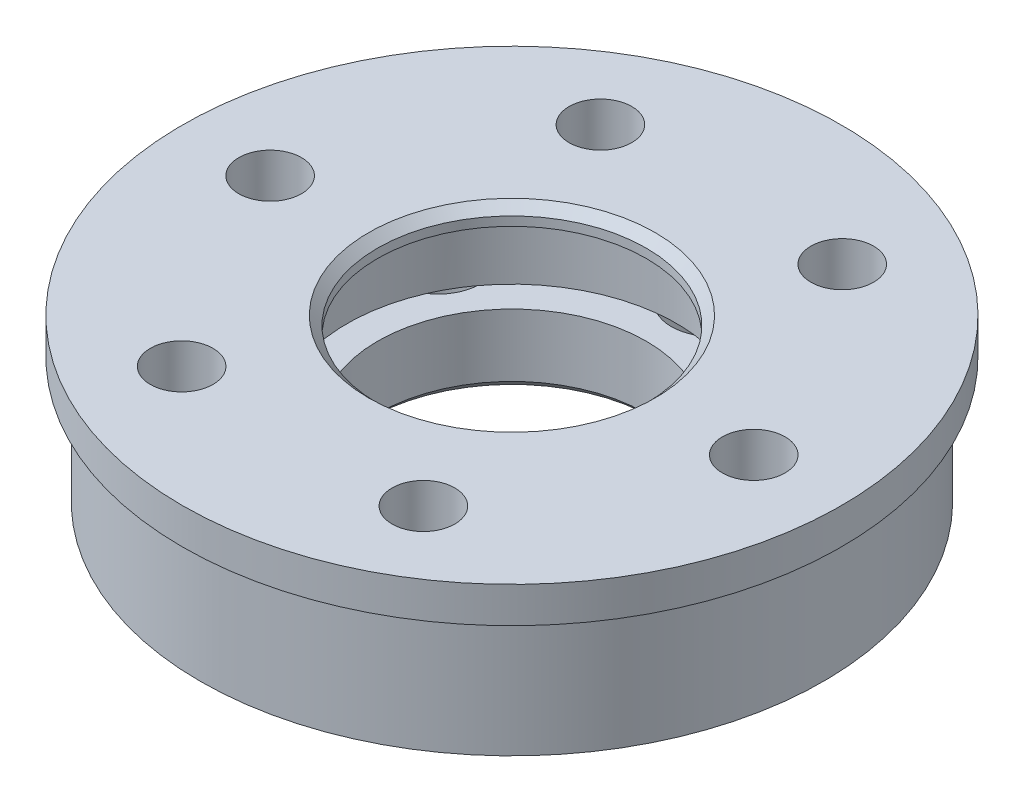
from build123d import *

# Parameters (mm, degrees)
SKETCH1_R           = 17.4
SKETCH1_R_2         = 1.75
SKETCH1_R_3         = 7.5
BOSS_EXTRUDE1_DEPTH = 4.5
CUT_EXTRUDE1_START  = -0.5
SKETCH2_R           = 9.2
CUT_EXTRUDE1_DEPTH  = 4
SKETCH3_R           = 15.25
SKETCH3_R_2         = 11.75
BOSS_EXTRUDE2_DEPTH = 1.5
CHAMFER1_SIZE       = 0.5
SKETCH4_R           = 18.4
SKETCH4_R_2         = 17.4
BOSS_EXTRUDE3_DEPTH = 2
SKETCH5_R           = 2.35
CUT_EXTRUDE2_DEPTH  = 4


with BuildPart() as part:
    # Sketch1 → Boss-Extrude1 (new, symmetric)
    with BuildSketch(Plane(origin=(0, 0, 0), x_dir=(1, 0, 0), z_dir=(0, 1, 0))):
        Circle(SKETCH1_R)
        with Locations((13.5, 0)):
            Circle(SKETCH1_R_2, mode=Mode.SUBTRACT)
        with Locations((6.75, -11.691342951)):
            Circle(SKETCH1_R_2, mode=Mode.SUBTRACT)
        with Locations((-6.75, -11.691342951)):
            Circle(SKETCH1_R_2, mode=Mode.SUBTRACT)
        with Locations((-13.5, 0)):
            Circle(SKETCH1_R_2, mode=Mode.SUBTRACT)
        with Locations((-6.75, 11.691342951)):
            Circle(SKETCH1_R_2, mode=Mode.SUBTRACT)
        with Locations((6.75, 11.691342951)):
            Circle(SKETCH1_R_2, mode=Mode.SUBTRACT)
        Circle(SKETCH1_R_3, mode=Mode.SUBTRACT)
    extrude(amount=BOSS_EXTRUDE1_DEPTH, both=True)

    # Sketch2 → Cut-Extrude1 (cut)
    with BuildSketch(Plane(origin=(0, 0, 0), x_dir=(1, 0, 0), z_dir=(0, 1, 0)).offset(CUT_EXTRUDE1_START)):
        Circle(SKETCH2_R)
    extrude(amount=CUT_EXTRUDE1_DEPTH, mode=Mode.SUBTRACT)

    # Sketch3 → Boss-Extrude2 (add)
    with BuildSketch(Plane.XZ.offset(4.5)):
        Circle(SKETCH3_R)
        Circle(SKETCH3_R_2, mode=Mode.SUBTRACT)
    extrude(amount=-BOSS_EXTRUDE2_DEPTH)

    # Chamfer1
    chamfer1_edges = [part.edges().sort_by_distance(p)[0] for p in [
        (-7.5, -4.5, 0),
        (-7.5, 4.5, 0),
    ]]
    chamfer(chamfer1_edges, length=CHAMFER1_SIZE)

    # Sketch4 → Boss-Extrude3 (add)
    with BuildSketch(Plane(origin=(0, 4.5, 0), x_dir=(1, 0, 0), z_dir=(0, 1, 0))):
        Circle(SKETCH4_R)
        Circle(SKETCH4_R_2, mode=Mode.SUBTRACT)
    extrude(amount=-BOSS_EXTRUDE3_DEPTH)

    # Sketch5 → Cut-Extrude2 (cut)
    with BuildSketch(Plane(origin=(0, -4.5, 0), x_dir=(-1, 0, 0), z_dir=(0, -1, 0))):
        with Locations((-9.742785793, -5.625)):
            Circle(SKETCH5_R)
        with Locations((-9.742785793, 5.625)):
            Circle(SKETCH5_R)
        with Locations((0, 11.25)):
            Circle(SKETCH5_R)
        with Locations((9.742785793, 5.625)):
            Circle(SKETCH5_R)
        with Locations((9.742785793, -5.625)):
            Circle(SKETCH5_R)
        with Locations((0, -11.25)):
            Circle(SKETCH5_R)
    extrude(amount=-CUT_EXTRUDE2_DEPTH, mode=Mode.SUBTRACT)


solid = part.part
